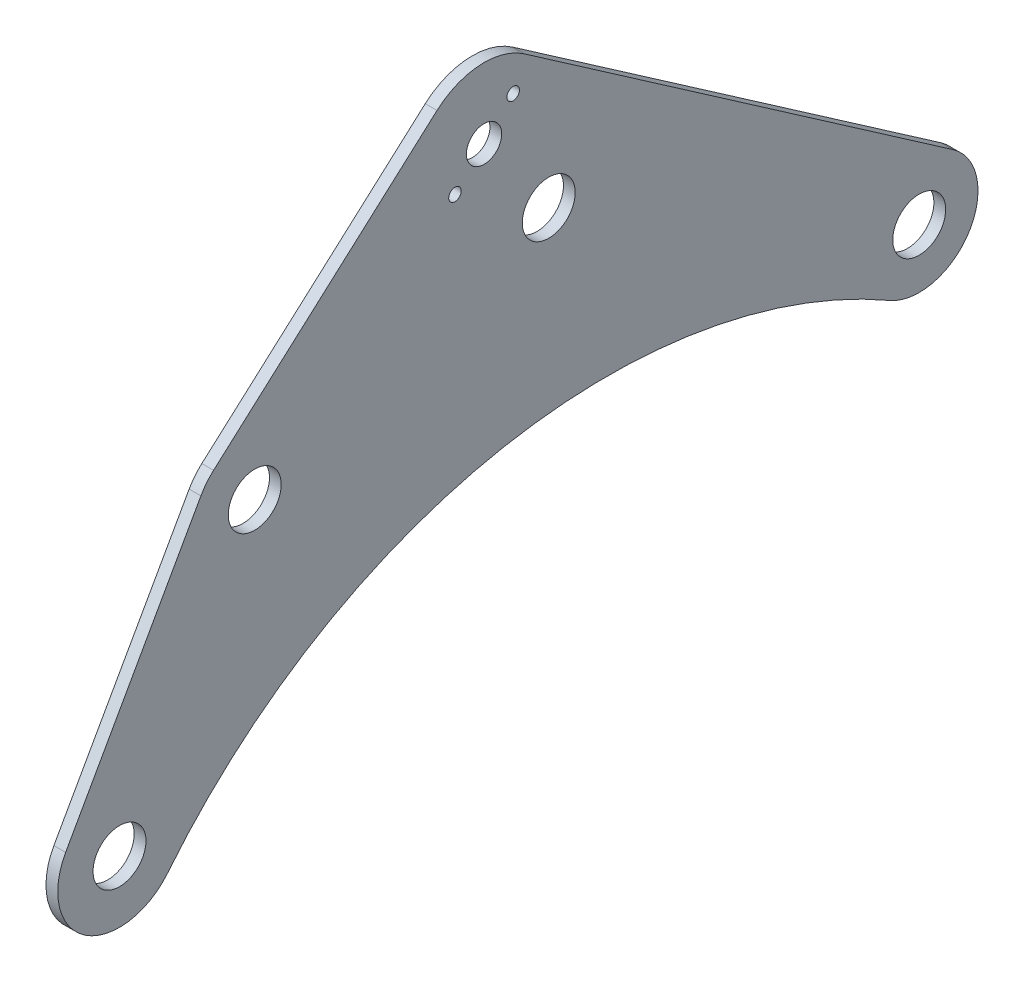
from build123d import *

# Parameters (mm, degrees)
BOSS_EXTRUDE1_DEPTH = 6.35
CUT_EXTRUDE1_REACH  = 505.742
SKETCH3_R           = 14.2875
SKETCH3_R_2         = 9.525
SKETCH3_R_3         = 3.3782


with BuildPart() as part:
    # Sketch2 → Boss-Extrude1 (new body)
    with BuildSketch(Plane(origin=(0, 0, 0), x_dir=(0, 0, -1), z_dir=(1, 0, 0))):
        with BuildLine():
            Line((-460.875068633, -63.064595645), (-387.850068633, 67.110404355))
            ThreePointArc((-387.850068633, 67.110404355), (-384.779344211, 71.660560596), (-381.003559726, 75.645121025))
            Line((-381.003559726, 75.645121025), (-260.354068258, 183.588424029))
            ThreePointArc((-260.354068258, 183.588424029), (-237.302476246, 193.221304079), (-213.239358387, 186.503072818))
            Line((-213.239358387, 186.503072818), (18.092201344, 26.090894015))
            ThreePointArc((18.092201344, 26.090894015), (26.813167045, -17.003428272), (-15.885860716, -27.490033272))
            ThreePointArc((-15.885860716, -27.490033272), (-224.319084527, 8.230398172), (-405.830012185, -100.278316462))
            ThreePointArc((-405.830012185, -100.278316462), (-450.471519381, -106.993169205), (-460.875068633, -63.064595645))
        make_face()
    extrude(amount=BOSS_EXTRUDE1_DEPTH)

    # Sketch3 → Cut-Extrude1 (cut, up to next)
    with BuildSketch(Plane(origin=(6.35, 0, 0), x_dir=(0, 0, -1), z_dir=(1, 0, 0)), mode=Mode.PRIVATE) as cut_extrude1_sk1:
        with Locations((-200.025, 107.95)):
            Circle(SKETCH3_R)
    cut_extrude1_tool1 = extrude(cut_extrude1_sk1.sketch, amount=-CUT_EXTRUDE1_REACH, mode=Mode.PRIVATE) & part.part
    # Sketch3 → Cut-Extrude1 (cut, up to next)
    with BuildSketch(Plane(origin=(6.35, 0, 0), x_dir=(0, 0, -1), z_dir=(1, 0, 0)), mode=Mode.PRIVATE) as cut_extrude1_sk2:
        with Locations((-358.775, 50.8)):
            Circle(SKETCH3_R)
    cut_extrude1_tool2 = extrude(cut_extrude1_sk2.sketch, amount=-CUT_EXTRUDE1_REACH, mode=Mode.PRIVATE) & part.part
    # Sketch3 → Cut-Extrude1 (cut, up to next)
    with BuildSketch(Plane(origin=(6.35, 0, 0), x_dir=(0, 0, -1), z_dir=(1, 0, 0)), mode=Mode.PRIVATE) as cut_extrude1_sk3:
        with Locations((-431.8, -79.375)):
            Circle(SKETCH3_R)
    cut_extrude1_tool3 = extrude(cut_extrude1_sk3.sketch, amount=-CUT_EXTRUDE1_REACH, mode=Mode.PRIVATE) & part.part
    # Sketch3 → Cut-Extrude1 (cut, up to next)
    with BuildSketch(Plane(origin=(6.35, 0, 0), x_dir=(0, 0, -1), z_dir=(1, 0, 0)), mode=Mode.PRIVATE) as cut_extrude1_sk4:
        with Locations((-234.95, 155.194)):
            Circle(SKETCH3_R_2)
    cut_extrude1_tool4 = extrude(cut_extrude1_sk4.sketch, amount=-CUT_EXTRUDE1_REACH, mode=Mode.PRIVATE) & part.part
    # Sketch3 → Cut-Extrude1 (cut, up to next)
    with BuildSketch(Plane(origin=(6.35, 0, 0), x_dir=(0, 0, -1), z_dir=(1, 0, 0)), mode=Mode.PRIVATE) as cut_extrude1_sk5:
        Circle(SKETCH3_R)
    cut_extrude1_tool5 = extrude(cut_extrude1_sk5.sketch, amount=-CUT_EXTRUDE1_REACH, mode=Mode.PRIVATE) & part.part
    # Sketch3 → Cut-Extrude1 (cut, up to next)
    with BuildSketch(Plane(origin=(6.35, 0, 0), x_dir=(0, 0, -1), z_dir=(1, 0, 0)), mode=Mode.PRIVATE) as cut_extrude1_sk6:
        with Locations((-250.665448212, 139.478551788)):
            Circle(SKETCH3_R_3)
    cut_extrude1_tool6 = extrude(cut_extrude1_sk6.sketch, amount=-CUT_EXTRUDE1_REACH, mode=Mode.PRIVATE) & part.part
    # Sketch3 → Cut-Extrude1 (cut, up to next)
    with BuildSketch(Plane(origin=(6.35, 0, 0), x_dir=(0, 0, -1), z_dir=(1, 0, 0)), mode=Mode.PRIVATE) as cut_extrude1_sk7:
        with Locations((-219.234551788, 170.909448212)):
            Circle(SKETCH3_R_3)
    cut_extrude1_tool7 = extrude(cut_extrude1_sk7.sketch, amount=-CUT_EXTRUDE1_REACH, mode=Mode.PRIVATE) & part.part
    add(cut_extrude1_tool1.solids().sort_by_distance((6.35, 107.95, 200.025))[0], mode=Mode.SUBTRACT)
    add(cut_extrude1_tool2.solids().sort_by_distance((6.35, 50.8, 358.775))[0], mode=Mode.SUBTRACT)
    add(cut_extrude1_tool3.solids().sort_by_distance((6.35, -79.375, 431.8))[0], mode=Mode.SUBTRACT)
    add(cut_extrude1_tool4.solids().sort_by_distance((6.35, 155.194, 234.95))[0], mode=Mode.SUBTRACT)
    add(cut_extrude1_tool5.solids().sort_by_distance((6.35, 0, 0))[0], mode=Mode.SUBTRACT)
    add(cut_extrude1_tool6.solids().sort_by_distance((6.35, 139.478552, 250.665448))[0], mode=Mode.SUBTRACT)
    add(cut_extrude1_tool7.solids().sort_by_distance((6.35, 170.909448, 219.234552))[0], mode=Mode.SUBTRACT)


solid = part.part
